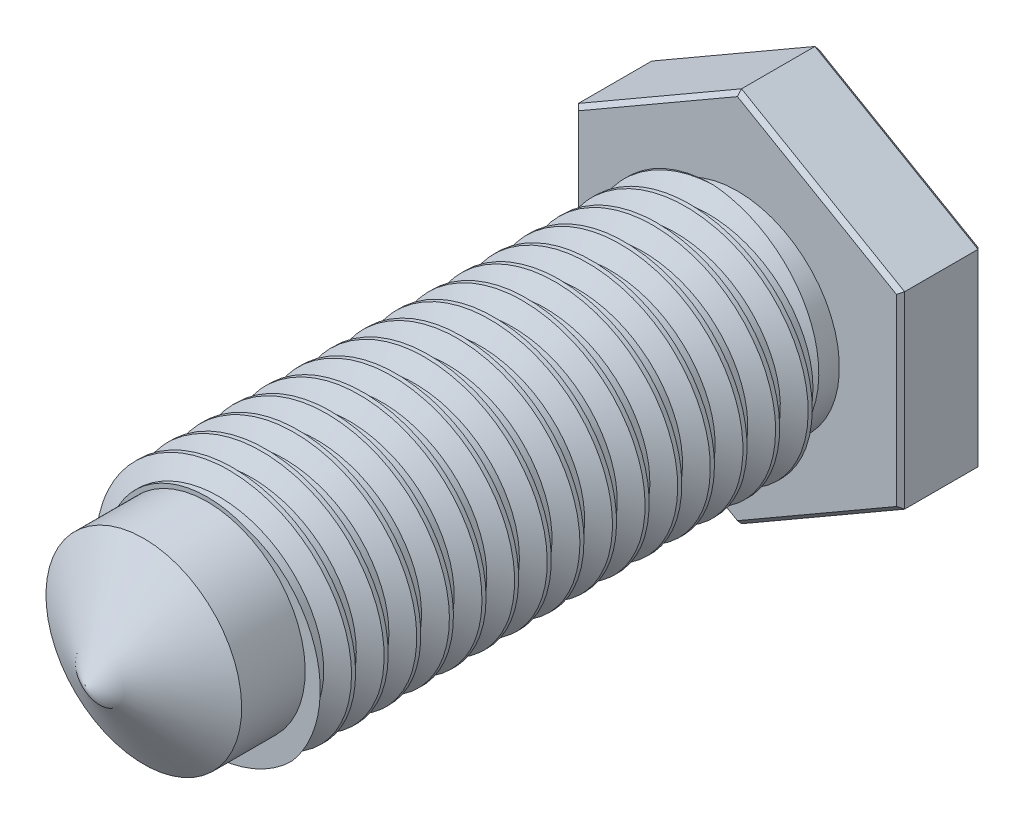
from build123d import *

# Parameters (mm, degrees)
THREAD1_PITCH      = 0.8
SKETCH5_R          = 5.21040517
CUT_EXTRUDE1_DEPTH = 10
CHAMFER1_SIZE      = 0.1
CUT_EXTRUDE2_START = 3
SKETCH7_R          = 2.9330127
SKETCH7_R_2        = 2.4
CUT_EXTRUDE2_DEPTH = 3


with BuildPart() as part:
    # Sketch1 → Revolve1 (revolve)
    with BuildSketch(Plane(origin=(0, 0, 0), x_dir=(0, 0, -1), z_dir=(1, 0, 0))):
        Polygon((-16.237668173, 2.9330127), (-2.6, 2.9330127), (-2.6, 2.5), (-2, 2.5), (-2, 5), (0, 5), (0, 0), (-18, 0), align=None)
    revolve(axis=Axis((0, 0, 0), (0, 0, 1)))

    # Thread1: arcs per turn and ends read off the stored shape
    # Thread1: the profile of Thread Profile1 profile screwed along a right-hand helix through 35 turns, 8 arcs to a turn; built about Z, then put on its axis
    thread1_z = Axis((0, 0, 0), (0, 0, 1))
    thread1_corners = [(2.9333127, 0, -28.000173205), (2.9333127, 0, -27.299826797), (2.5, 0, -27.550000001), (2.5, 0, -27.750000001)]
    with BuildLine(mode=Mode.PRIVATE) as thread1_profile:
        Line(thread1_corners[0], thread1_corners[1])
        Line(thread1_corners[1], thread1_corners[2])
        Line(thread1_corners[2], thread1_corners[3])
        Line(thread1_corners[3], thread1_corners[0])
    thread1_cap = Face(thread1_profile.wire())
    thread1_turn_angles = [0, 22.5, 45, 67.5, 90, 112.5, 135, 157.5, 180, 202.5, 225, 247.5, 270, 292.5, 315, 337.5, 360]
    thread1_turn_weights = [1, 0.9238795325112867, 1, 0.9238795325112867, 1, 0.9238795325112867, 1, 0.9238795325112867, 1, 0.9238795325112867, 1, 0.9238795325112867, 1, 0.9238795325112867, 1, 0.9238795325112867, 1]
    thread1_turn_rails = [Edge.make_bspline([Vector(p[0], p[1], 0).rotate(thread1_z, thread1_turn_angles[k]) / thread1_turn_weights[k] + Vector(0, 0, p[2] + THREAD1_PITCH * thread1_turn_angles[k] / 360) for k in range(17)], [0, 0, 0, 1, 1, 2, 2, 3, 3, 4, 4, 5, 5, 6, 6, 7, 7, 8, 8, 8], 2, thread1_turn_weights) for p in thread1_corners]
    thread1_turn_sides = [Face.make_surface_from_curves(thread1_turn_rails[p[0]], thread1_turn_rails[p[1]]) for p in [(0, 1), (1, 2), (2, 3), (3, 0)]]
    thread1 = Plane(origin=(0, 0, 2.7), x_dir=(-1, 0, 0), z_dir=(0, 0, -1)) * Solid(Shell([*[p.moved(Location((0, 0, THREAD1_PITCH * i))) for i in range(35) for p in thread1_turn_sides], thread1_cap, thread1_cap.rotate(thread1_z, 12600).moved(Location((0, 0, THREAD1_PITCH * 12600 / 360)))]))
    add(thread1, mode=Mode.SUBTRACT)

    # Sketch5 → Cut-Extrude1 (cut)
    with BuildSketch(Plane(origin=(0, 0, 0), x_dir=(-1, 0, 0), z_dir=(0, 0, -1))):
        Circle(SKETCH5_R)
        Polygon((0, 4.618802154), (-4, 2.309401077), (-4, -2.309401077), (0, -4.618802154), (4, -2.309401077), (4, 2.309401077), align=None, mode=Mode.SUBTRACT)
    extrude(amount=-CUT_EXTRUDE1_DEPTH, mode=Mode.SUBTRACT)

    # Chamfer1
    chamfer1_edges = [part.edges().sort_by_distance(p)[0] for p in [
        (-2, 3.464101615, 2),
        (-2, 3.464101615, 0),
        (-4, 0, 2),
        (-4, 0, 0),
        (-2, -3.464101615, 2),
        (-2, -3.464101615, 0),
        (2, -3.464101615, 2),
        (2, -3.464101615, 0),
        (4, 0, 2),
        (4, 0, 0),
        (2, 3.464101615, 2),
        (2, 3.464101615, 0),
    ]]
    chamfer(chamfer1_edges, length=CHAMFER1_SIZE)

    # Sketch7 → Cut-Extrude2 (cut)
    with BuildSketch(Plane(origin=(0, 0, 18), x_dir=(-1, 0, 0), z_dir=(0, 0, -1)).offset(CUT_EXTRUDE2_START)):
        Circle(SKETCH7_R)
        with Locations(Location((0, 0, 0), (0, 0, 90))):
            Circle(SKETCH7_R_2, mode=Mode.SUBTRACT)
    extrude(amount=-CUT_EXTRUDE2_DEPTH, mode=Mode.SUBTRACT)


solid = part.part
